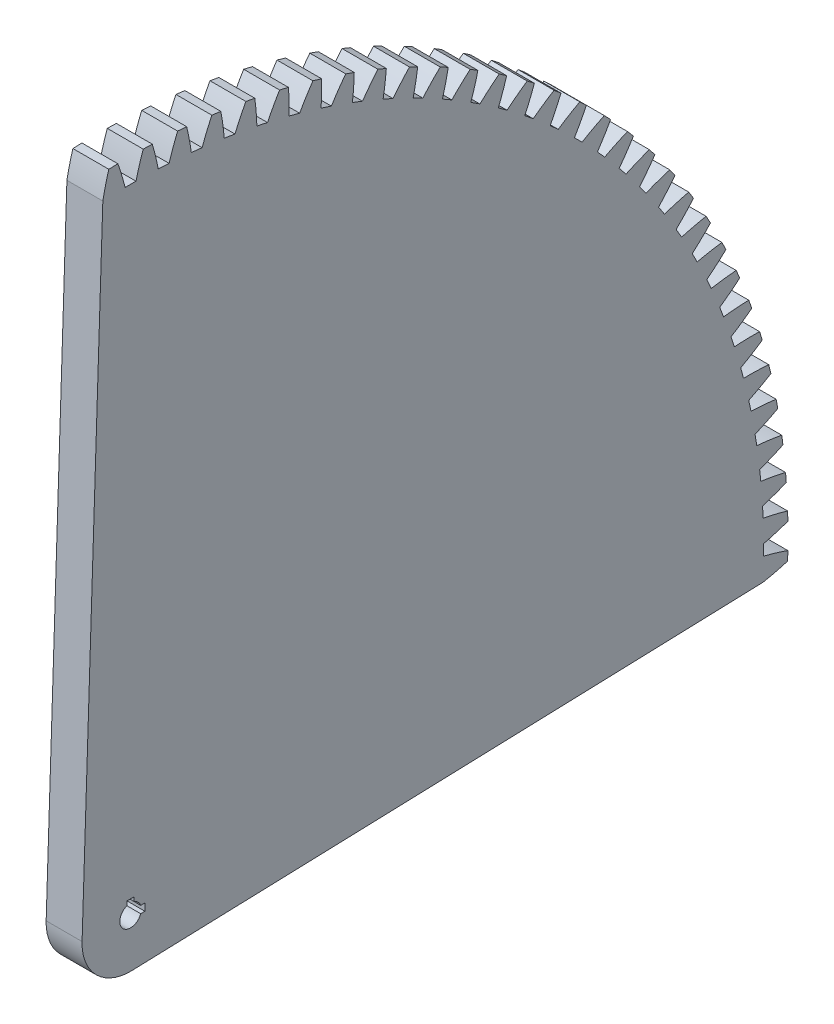
from build123d import *

# Parameters (mm, degrees)
BASPROSKE_W        = 10
BASPROSKE_H        = 183
TOOTHCUT_DEPTH     = 259.994208429
TEETHCUTS_COUNT    = 120
TEETHCUTS_ANGLE    = 357
BORSKE_R           = 3
BORE_DEPTH         = 50.0000508
KEYSKE_W           = 2
KEYSKE_H           = 4
KEYWAY_DEPTH       = 50.0000508
KEYWAY2_COUNT      = 2
KEYWAY2_ANGLE      = 90
CUT_EXTRUDE1_DEPTH = 259.946207215


with BuildPart() as part:
    # BasProSke → Base-Revolve (revolve)
    with BuildSketch(Plane(origin=(0, 0, 0), x_dir=(1, 0, 0), z_dir=(0, 1, 0)), mode=Mode.PRIVATE) as base_revolve_sk:
        with Locations((5, 91.5)):
            Rectangle(BASPROSKE_W, BASPROSKE_H)
    revolve(base_revolve_sk.sketch.rotate(Axis((-10, 0, 0), (1, 0, 0)), 180), axis=Axis((-10, 0, 0), (1, 0, 0)))

    # TooCutSke → ToothCut (cut, through all)
    with BuildSketch(Plane(origin=(0, 0, 0), x_dir=(0, 0, -1), z_dir=(1, 0, 0))):
        with BuildLine():
            ThreePointArc((1.51134717, 176.242519928), (0, 176.249), (-1.51134717, 176.242519928))
            ThreePointArc((-1.51134717, 176.242519928), (-2.440411129, 179.641656325), (-3.534672788, 182.991265183))
            ThreePointArc((-3.534672788, 182.991265183), (0, 183.0254), (3.534672788, 182.991265183))
            ThreePointArc((3.534672788, 182.991265183), (2.440411129, 179.641656325), (1.51134717, 176.242519928))
        make_face()
    toothcut = extrude(amount=TOOTHCUT_DEPTH, mode=Mode.SUBTRACT)

    # TeethCuts: ToothCut ×120 about axis
    teethcuts_axis = Axis((-10, 0, 0), (1, 0, 0))
    for i in range(1, TEETHCUTS_COUNT):
        add(toothcut.rotate(teethcuts_axis, i * TEETHCUTS_ANGLE / (TEETHCUTS_COUNT - 1)), mode=Mode.SUBTRACT)

    # BorSke → Bore (cut, symmetric)
    with BuildSketch(Plane(origin=(0, 0, 0), x_dir=(0, 0, -1), z_dir=(1, 0, 0))):
        with Locations(Location((0, 0, 0), (0, 0, 180))):
            Circle(BORSKE_R)
    extrude(amount=BORE_DEPTH, both=True, mode=Mode.SUBTRACT)

    # KeySke → Keyway (cut, symmetric)
    with BuildSketch(Plane(origin=(0, 0, 0), x_dir=(0, 0, -1), z_dir=(1, 0, 0))):
        with Locations((0, 2)):
            Rectangle(KEYSKE_W, KEYSKE_H)
    keyway = extrude(amount=KEYWAY_DEPTH, both=True, mode=Mode.SUBTRACT)

    # Keyway2: Keyway ×2 about axis
    keyway2_axis = Axis((0, 0, 0), (-1, 0, 0))
    for i in range(1, KEYWAY2_COUNT):
        add(keyway.rotate(keyway2_axis, i * KEYWAY2_ANGLE / (KEYWAY2_COUNT - 1)), mode=Mode.SUBTRACT)

    # Sketch1 → Cut-Extrude1 (cut, through all)
    with BuildSketch(Plane(origin=(10, 0, 0), x_dir=(0, 0, -1), z_dir=(1, 0, 0))):
        with BuildLine():
            Line((176.080083479, -7.71454489), (0.443888689, -13.492700354))
            ThreePointArc((0.443888689, -13.492700354), (-9.545941546, -9.545941546), (-13.492700354, 0.443888689))
            Line((-13.492700354, 0.443888689), (-7.71454489, 176.080083479))
            Line((-7.71454489, 176.080083479), (-14.251827406, 194.700723838))
            Line((-14.251827406, 194.700723838), (-32.749780015, 211.870036755))
            Line((-32.749780015, 211.870036755), (-115.066994713, 184.879129582))
            Line((-115.066994713, 184.879129582), (-189.395687031, 62.84812364))
            Line((-189.395687031, 62.84812364), (-203.232112927, -19.149114264))
            Line((-203.232112927, -19.149114264), (-161.479992923, -112.268128157))
            Line((-161.479992923, -112.268128157), (-102.832278001, -176.057436953))
            Line((-102.832278001, -176.057436953), (0.443888689, -208.07803376))
            Line((0.443888689, -208.07803376), (141.643568474, -161.780215449))
            Line((141.643568474, -161.780215449), (187.805581807, -54.591848009))
            Line((187.805581807, -54.591848009), (186.310919547, -8.498456478))
            Line((186.310919547, -8.498456478), (176.080083479, -7.71454489))
        make_face()
    extrude(amount=-CUT_EXTRUDE1_DEPTH, mode=Mode.SUBTRACT)


solid = part.part
